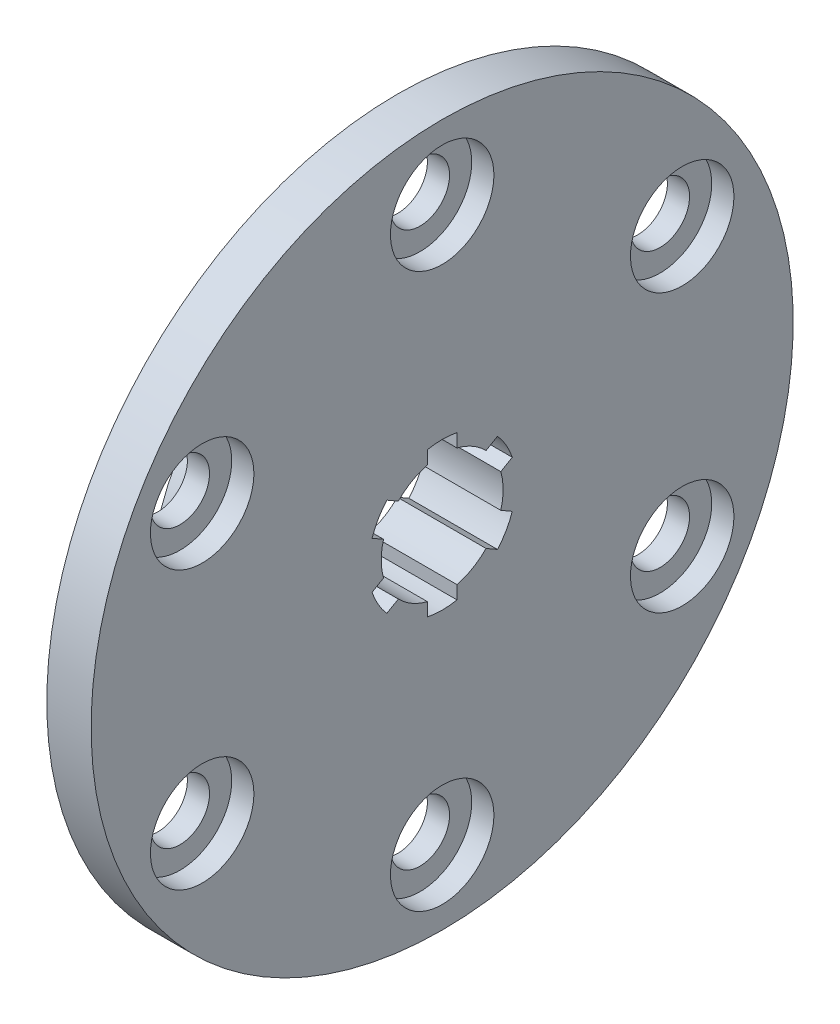
from build123d import *

# Parameters (mm, degrees)
BOSS_EXTRUDE1_OUTLINE_R = 47.5
BOSS_EXTRUDE1_DEPTH     = 6
SKETCH3_R               = 27.5
BOSS_EXTRUDE2_DEPTH     = 6
SKETCH1_3_R             = 4
CUT_EXTRUDE1_DEPTH      = 6
CUT_EXTRUDE2_START      = 3
SKETCH1_4_R             = 7
SKETCH1_4_R_2           = 4
CUT_EXTRUDE2_DEPTH      = 3
CIRPATTERN1_COUNT       = 6
CUT_EXTRUDE3_START      = -58.6
SKETCH4_R               = 8.25
CUT_EXTRUDE3_DEPTH      = 1158.065603692
CUT_EXTRUDE5_DEPTH      = 1216.665603692


# Read off the part's stored shape, not the designer's step: Boss-Extrude1
with BuildPart() as part:
    # Boss-Extrude1 outline → Boss-Extrude1 (new body)
    with BuildSketch(Plane(origin=(-64.6, 0, 0), x_dir=(0, 0, -1), z_dir=(1, 0, 0))):
        with Locations((1115, 301)):
            Circle(BOSS_EXTRUDE1_OUTLINE_R)
    extrude(amount=BOSS_EXTRUDE1_DEPTH)

    # Sketch3 → Boss-Extrude2 (add)
    with BuildSketch(Plane(origin=(-64.6, 0, 0), x_dir=(0, 0, -1), z_dir=(1, 0, 0))):
        with Locations(Location((1115, 301, 0), (0, 0, 90))):
            Circle(SKETCH3_R)
    extrude(amount=-BOSS_EXTRUDE2_DEPTH)

    # Sketch1<3> → Cut-Extrude1 (cut)
    with BuildSketch(Plane(origin=(-64.6, 0, 0), x_dir=(0, 0, -1), z_dir=(1, 0, 0))):
        with Locations(Location((1115, 338.5, 0), (0, 0, 90))):
            Circle(SKETCH1_3_R)
    cut_extrude1 = extrude(amount=CUT_EXTRUDE1_DEPTH, mode=Mode.SUBTRACT)

    # Sketch1<4> → Cut-Extrude2 (cut)
    with BuildSketch(Plane(origin=(-64.6, 0, 0), x_dir=(0, 0, -1), z_dir=(1, 0, 0)).offset(CUT_EXTRUDE2_START)):
        with Locations(Location((1115, 338.5, 0), (0, 0, 90))):
            Circle(SKETCH1_4_R)
        with Locations(Location((1115, 338.5, 0), (0, 0, 90))):
            Circle(SKETCH1_4_R_2, mode=Mode.SUBTRACT)
    cut_extrude2 = extrude(amount=CUT_EXTRUDE2_DEPTH, mode=Mode.SUBTRACT)

    # CirPattern1: Cut-Extrude1, Cut-Extrude2 ×6 about axis
    cirpattern1_axis = Axis((0, 301, -1115), (1, 0, 0))
    add([cut_extrude1.rotate(cirpattern1_axis, i * 360 / CIRPATTERN1_COUNT) for i in range(1, CIRPATTERN1_COUNT)], mode=Mode.SUBTRACT)
    add([cut_extrude2.rotate(cirpattern1_axis, i * 360 / CIRPATTERN1_COUNT) for i in range(1, CIRPATTERN1_COUNT)], mode=Mode.SUBTRACT)

    # Sketch4 → Cut-Extrude3 (cut, through all)
    with BuildSketch(Plane(origin=(0, 0, 0), x_dir=(0, 0, -1), z_dir=(1, 0, 0)).offset(CUT_EXTRUDE3_START)):
        with Locations(Location((1115, 301, 0), (0, 0, 90))):
            Circle(SKETCH4_R)
    extrude(amount=-CUT_EXTRUDE3_DEPTH, mode=Mode.SUBTRACT)

    # Sketch5 → Cut-Extrude5 (cut, through all)
    with BuildSketch(Plane(origin=(0, 0, 0), x_dir=(0, 0, -1), z_dir=(1, 0, 0))):
        with BuildLine():
            Line((1117, 308.745966692), (1117, 310.797958971))
            ThreePointArc((1117, 310.797958971), (1115, 311), (1113, 310.797958971))
            Line((1113, 310.797958971), (1113, 308.745966692))
            ThreePointArc((1113, 308.745966692), (1115, 309), (1117, 308.745966692))
        make_face()
        with BuildLine():
            Line((1122.485281374, 307.631030293), (1120.708203932, 306.605034154))
            ThreePointArc((1120.708203932, 306.605034154), (1121.92820323, 305), (1122.708203932, 303.140932539))
            Line((1122.708203932, 303.140932539), (1124.485281374, 304.166928678))
            ThreePointArc((1124.485281374, 304.166928678), (1123.660254038, 306), (1122.485281374, 307.631030293))
        make_face()
        with BuildLine():
            ThreePointArc((1107.291796067, 303.140932539), (1108.07179677, 305), (1109.291796067, 306.605034154))
            Line((1109.291796067, 306.605034154), (1107.514718626, 307.631030293))
            ThreePointArc((1107.514718626, 307.631030293), (1106.339745962, 306), (1105.514718626, 304.166928678))
            Line((1105.514718626, 304.166928678), (1107.291796067, 303.140932539))
        make_face()
        with BuildLine():
            Line((1124.485281374, 297.833071322), (1122.708203932, 298.859067461))
            ThreePointArc((1122.708203932, 298.859067461), (1121.92820323, 297), (1120.708203932, 295.394965846))
            Line((1120.708203932, 295.394965846), (1122.485281374, 294.368969707))
            ThreePointArc((1122.485281374, 294.368969707), (1123.660254038, 296), (1124.485281374, 297.833071322))
        make_face()
        with BuildLine():
            ThreePointArc((1109.291796067, 295.394965846), (1108.07179677, 297), (1107.291796067, 298.859067461))
            Line((1107.291796067, 298.859067461), (1105.514718626, 297.833071322))
            ThreePointArc((1105.514718626, 297.833071322), (1106.339745962, 296), (1107.514718626, 294.368969707))
            Line((1107.514718626, 294.368969707), (1109.291796067, 295.394965846))
        make_face()
        with BuildLine():
            Line((1117, 291.202041029), (1117, 293.254033308))
            ThreePointArc((1117, 293.254033308), (1115, 293), (1113, 293.254033308))
            Line((1113, 293.254033308), (1113, 291.202041029))
            ThreePointArc((1113, 291.202041029), (1115, 291), (1117, 291.202041029))
        make_face()
    extrude(amount=-CUT_EXTRUDE5_DEPTH, mode=Mode.SUBTRACT)


solid = part.part
